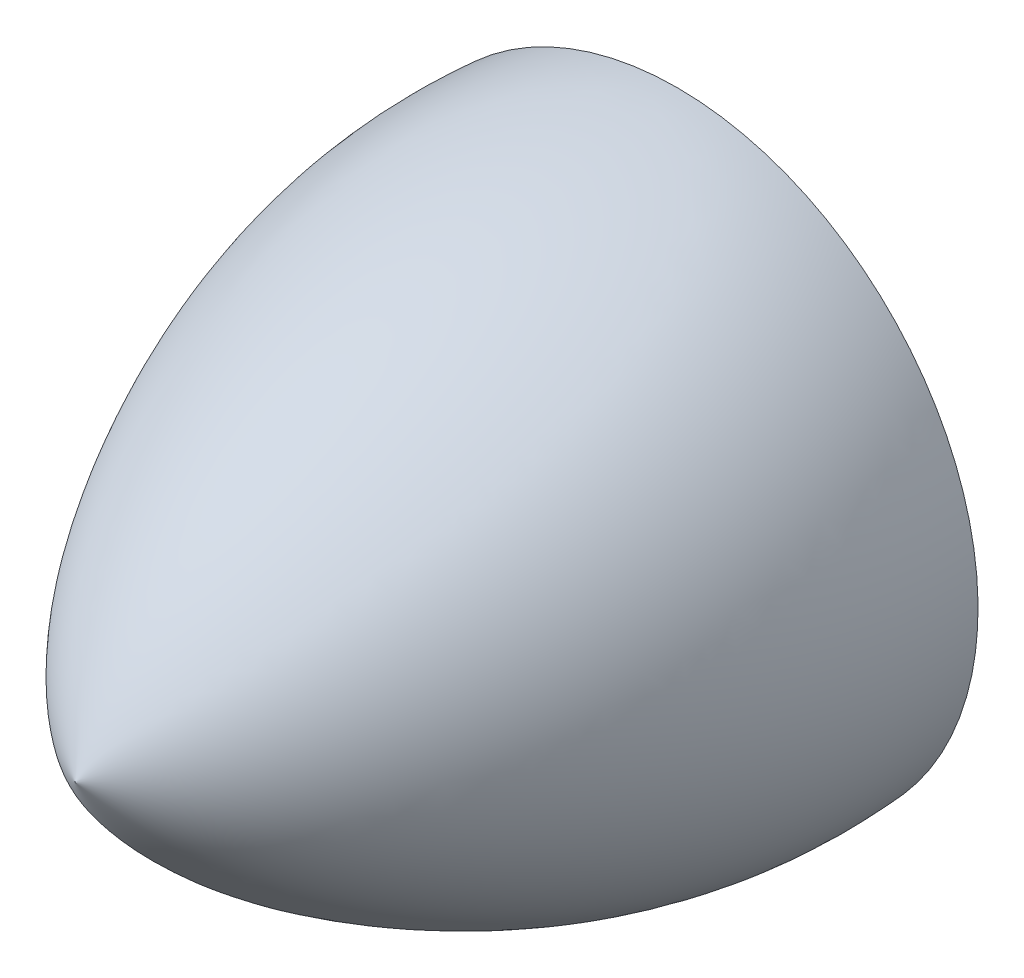
from build123d import *


with BuildPart() as part:
    # Sketch1 → Revolve1 (revolve)
    with BuildSketch(Plane(origin=(0, 0, 0), x_dir=(0, 0, -1), z_dir=(1, 0, 0))):
        with BuildLine():
            Line((-70.104, 0), (0, 0))
            Line((0, 0), (0, 35))
            add(Edge.make_bspline(
                [(-70.104, 0), (-64.61877021, 11.169619974), (-42.348010529, 28.804891159), (-15.522027433, 36.222966989), (0, 35)],
                knots=[0, 0, 0, 0, 0.446109601, 1, 1, 1, 1], degree=3))
        make_face()
    revolve(axis=Axis((0, 0, 0), (0, 0, 1)))


solid = part.part
